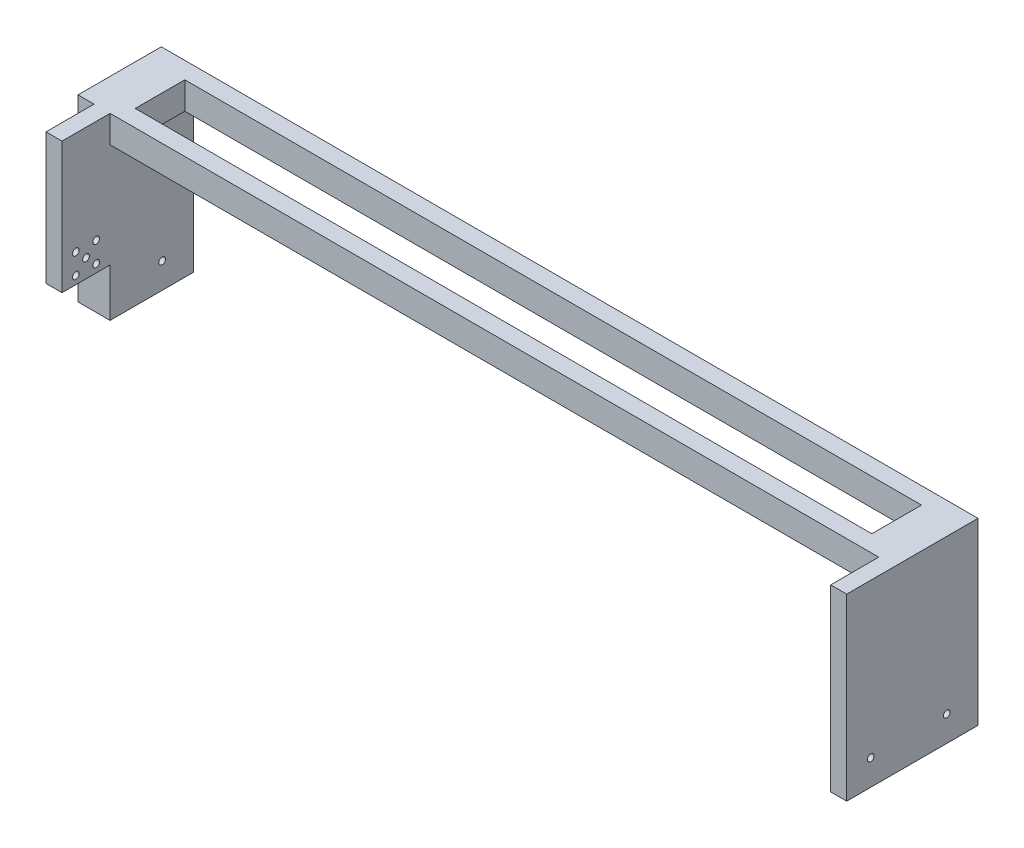
from build123d import *

# Parameters (mm, degrees)
BOSS_EXTRUDE1_DEPTH      = 82
BOSS_EXTRUDE1_DEPTH_BACK = 0.001
SKETCH2_W                = 480
SKETCH2_H                = 65
CUT_EXTRUDE2_DEPTH       = 82
SKETCH3_W                = 20
SKETCH3_H                = 52
SKETCH3_W_2              = 10
SKETCH3_H_2              = 82
BOSS_EXTRUDE3_DEPTH      = 30
SKETCH4_R                = 2.1
CUT_EXTRUDE3_DEPTH       = 618
SKETCH5_W                = 460.000000001
SKETCH5_H                = 31
CUT_EXTRUDE4_DEPTH       = 42
SKETCH6_R                = 2.1
CUT_EXTRUDE5_DEPTH       = 10


with BuildPart() as part:
    # Sketch1 → Boss-Extrude1 (new, two sides: drawn at the far end of the back side and taken through both)
    with BuildSketch(Plane(origin=(0, 0, 0), x_dir=(1, 0, 0), z_dir=(0, 1, 0)).offset(-BOSS_EXTRUDE1_DEPTH_BACK)):
        Polygon((10, -82), (10, -52), (0, -52), (0, 0), (510, 0), (510, -82), (500, -82), (500, -52), (20, -52), (20, -82), align=None)
    extrude(amount=BOSS_EXTRUDE1_DEPTH + BOSS_EXTRUDE1_DEPTH_BACK)

    # Sketch2 → Cut-Extrude2 (cut)
    with BuildSketch(Plane.XY):
        with Locations((260, 32.499)):
            Rectangle(SKETCH2_W, SKETCH2_H)
    extrude(amount=CUT_EXTRUDE2_DEPTH, mode=Mode.SUBTRACT)

    # Sketch3 → Boss-Extrude3 (add)
    with BuildSketch(Plane(origin=(0, 0, 0), x_dir=(1, 0, 0), z_dir=(0, 1, 0))):
        with Locations((10, -26)):
            Rectangle(SKETCH3_W, SKETCH3_H)
        with Locations((505, -41)):
            Rectangle(SKETCH3_W_2, SKETCH3_H_2)
    extrude(amount=-BOSS_EXTRUDE3_DEPTH)

    # Sketch4 → Cut-Extrude3 (cut)
    with BuildSketch(Plane(origin=(510, 0, 0), x_dir=(0, 0, -1), z_dir=(1, 0, 0))):
        with Locations((-67, -14.051)):
            Circle(SKETCH4_R)
        with Locations((-19.50000001, -14.05)):
            Circle(SKETCH4_R)
    extrude(amount=-CUT_EXTRUDE3_DEPTH, mode=Mode.SUBTRACT)

    # Sketch5 → Cut-Extrude4 (cut)
    with BuildSketch(Plane(origin=(0, 82, 0), x_dir=(1, 0, 0), z_dir=(0, 1, 0))):
        with Locations((255.200000001, -26)):
            Rectangle(SKETCH5_W, SKETCH5_H)
    extrude(amount=-CUT_EXTRUDE4_DEPTH, mode=Mode.SUBTRACT)

    # Sketch6 → Cut-Extrude5 (cut)
    with BuildSketch(Plane(origin=(20, 0, 0), x_dir=(0, 0, -1), z_dir=(1, 0, 0))):
        with Locations((-67, 11.349)):
            Circle(SKETCH6_R)
        with Locations((-60.65, 17.699)):
            Circle(SKETCH6_R)
        with Locations((-73.35, 17.699)):
            Circle(SKETCH6_R)
        with Locations((-73.35, 4.999)):
            Circle(SKETCH6_R)
        with Locations((-60.65, 4.999)):
            Circle(SKETCH6_R)
    extrude(amount=-CUT_EXTRUDE5_DEPTH, mode=Mode.SUBTRACT)


solid = part.part
